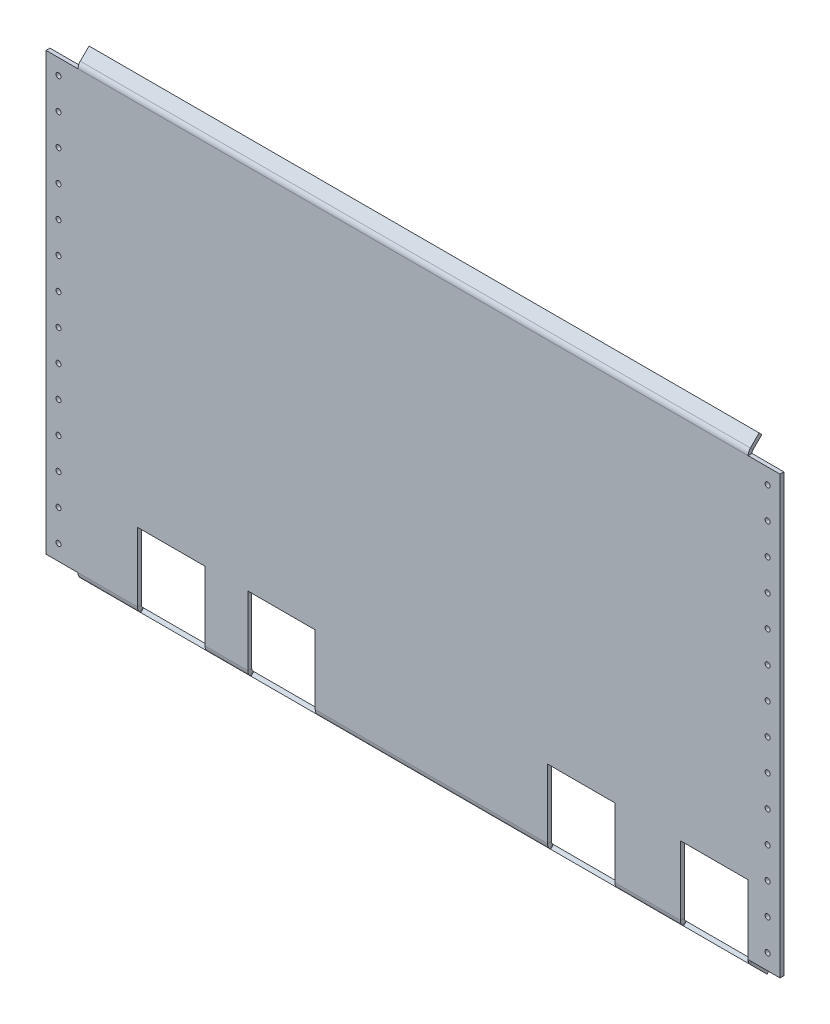
from build123d import *

# Parameters (mm, degrees)
SKETCH1_W                = 598.17
SKETCH1_H                = 355.6
BOSS_EXTRUDE1_DEPTH      = 3.175
EDGE_FLANGE1_DEPTH       = 546.1
EDGE_FLANGE2_DEPTH       = 546.1
SKETCH13_R               = 2.0701
CUT_EXTRUDE1_DEPTH       = 474.928155862
LPATTERN1_COUNT          = 14
LPATTERN1_PITCH          = 25.4
MIRROR1_COPY_1_SKETCH_R  = 2.0701
MIRROR1_COPY_1_DEPTH     = 474.928155862
MIRROR1_COPY_2_SKETCH_R  = 2.0701
MIRROR1_COPY_2_DEPTH     = 474.928155862
MIRROR1_COPY_3_SKETCH_R  = 2.0701
MIRROR1_COPY_3_DEPTH     = 474.928155862
MIRROR1_COPY_4_SKETCH_R  = 2.0701
MIRROR1_COPY_4_DEPTH     = 474.928155862
MIRROR1_COPY_5_SKETCH_R  = 2.0701
MIRROR1_COPY_5_DEPTH     = 474.928155862
MIRROR1_COPY_6_SKETCH_R  = 2.0701
MIRROR1_COPY_6_DEPTH     = 474.928155862
MIRROR1_COPY_7_SKETCH_R  = 2.0701
MIRROR1_COPY_7_DEPTH     = 474.928155862
MIRROR1_COPY_8_SKETCH_R  = 2.0701
MIRROR1_COPY_8_DEPTH     = 474.928155862
MIRROR1_COPY_9_SKETCH_R  = 2.0701
MIRROR1_COPY_9_DEPTH     = 474.928155862
MIRROR1_COPY_10_SKETCH_R = 2.0701
MIRROR1_COPY_10_DEPTH    = 474.928155862
MIRROR1_COPY_11_SKETCH_R = 2.0701
MIRROR1_COPY_11_DEPTH    = 474.928155862
MIRROR1_COPY_12_SKETCH_R = 2.0701
MIRROR1_COPY_12_DEPTH    = 474.928155862
MIRROR1_COPY_13_SKETCH_R = 2.0701
MIRROR1_COPY_13_DEPTH    = 474.928155862
CUT_EXTRUDE2_START       = -224.492278251
CUT_EXTRUDE2_DEPTH       = 54.911587961
CUT_EXTRUDE2_START_2     = -134.630234215
CUT_EXTRUDE2_2_DEPTH     = 54.911587961
CUT_EXTRUDE2_START_3     = 109.584512833
CUT_EXTRUDE2_3_DEPTH     = 54.911587961
CUT_EXTRUDE2_START_4     = 217.879930564
CUT_EXTRUDE2_4_DEPTH     = 54.911587961


# Read off the part's stored shape, not the designer's step: Cut-Extrude2
# Sheet-metal steps are written as plain solids
with BuildPart() as part:
    # Sketch1 → Boss-Extrude1 (new body)
    with BuildSketch(Plane.XY.offset(370.818659046)):
        with Locations((0, 177.8)):
            Rectangle(SKETCH1_W, SKETCH1_H)
    extrude(amount=BOSS_EXTRUDE1_DEPTH)

    # Edge-Flange1 section (across the edge) → Edge-Flange1 (add)
    with BuildSketch(Plane(origin=(273.05, -1.315128061, 370.818659046), x_dir=(0, 0.7071067811865438, -0.7071067811865512), z_dir=(-1, 0, 0))):
        with BuildLine():
            Line((-3.175, 1.315128061), (-3.175, 20.509847662))
            Line((-3.175, 20.509847662), (0, 20.509847662))
            Line((0, 20.509847662), (0, 1.315128061))
            ThreePointArc((0, 1.315128061), (0.241682484, 0.100108163), (0.92993597, -0.92993597))
            Line((0.92993597, -0.92993597), (-1.315128061, -3.175))
            ThreePointArc((-1.315128061, -3.175), (-2.691635031, -1.114911735), (-3.175, 1.315128061))
        make_face()
    extrude(amount=EDGE_FLANGE1_DEPTH)

    # Edge-Flange2 section (across the edge) → Edge-Flange2 (add)
    with BuildSketch(Plane(origin=(-273.05, 356.915128061, 370.818659046), x_dir=(0, -0.7071067811865438, -0.7071067811865512), z_dir=(1, 0, 0))):
        with BuildLine():
            Line((-3.175, 1.315128061), (-3.175, 11.384871939))
            Line((-3.175, 11.384871939), (0, 11.384871939))
            Line((0, 11.384871939), (0, 1.315128061))
            ThreePointArc((0, 1.315128061), (0.241682484, 0.100108163), (0.92993597, -0.92993597))
            Line((0.92993597, -0.92993597), (-1.315128061, -3.175))
            ThreePointArc((-1.315128061, -3.175), (-2.691635031, -1.114911735), (-3.175, 1.315128061))
        make_face()
    extrude(amount=EDGE_FLANGE2_DEPTH)

    # Sketch13 → Cut-Extrude1 (cut, symmetric)
    with BuildSketch(Plane.XY.offset(373.993659046)):
        with Locations(Location((-288.925, 342.9, 0), (0, 0, 180))):
            Circle(SKETCH13_R)
    cut_extrude1 = extrude(amount=CUT_EXTRUDE1_DEPTH, both=True, mode=Mode.SUBTRACT)

    # LPattern1: Cut-Extrude1 ×14
    with Locations(*[(0, -i * LPATTERN1_PITCH, 0) for i in range(1, LPATTERN1_COUNT)]):
        add(cut_extrude1, mode=Mode.SUBTRACT)

    # Mirror1: Cut-Extrude1 across plane
    add(cut_extrude1.mirror(Plane.ZY), mode=Mode.SUBTRACT)

    # Mirror1 copy 1 sketch → Mirror1 copy 1 (cut, symmetric)
    with BuildSketch(Plane(origin=(0, -25.4, 373.993659046), x_dir=(-1, 0, 0), z_dir=(0, 0, 1))):
        with Locations((-288.925, -342.9)):
            Circle(MIRROR1_COPY_1_SKETCH_R)
    extrude(amount=MIRROR1_COPY_1_DEPTH, both=True, mode=Mode.SUBTRACT)

    # Mirror1 copy 2 sketch → Mirror1 copy 2 (cut, symmetric)
    with BuildSketch(Plane(origin=(0, -50.8, 373.993659046), x_dir=(-1, 0, 0), z_dir=(0, 0, 1))):
        with Locations((-288.925, -342.9)):
            Circle(MIRROR1_COPY_2_SKETCH_R)
    extrude(amount=MIRROR1_COPY_2_DEPTH, both=True, mode=Mode.SUBTRACT)

    # Mirror1 copy 3 sketch → Mirror1 copy 3 (cut, symmetric)
    with BuildSketch(Plane(origin=(0, -76.2, 373.993659046), x_dir=(-1, 0, 0), z_dir=(0, 0, 1))):
        with Locations((-288.925, -342.9)):
            Circle(MIRROR1_COPY_3_SKETCH_R)
    extrude(amount=MIRROR1_COPY_3_DEPTH, both=True, mode=Mode.SUBTRACT)

    # Mirror1 copy 4 sketch → Mirror1 copy 4 (cut, symmetric)
    with BuildSketch(Plane(origin=(0, -101.6, 373.993659046), x_dir=(-1, 0, 0), z_dir=(0, 0, 1))):
        with Locations((-288.925, -342.9)):
            Circle(MIRROR1_COPY_4_SKETCH_R)
    extrude(amount=MIRROR1_COPY_4_DEPTH, both=True, mode=Mode.SUBTRACT)

    # Mirror1 copy 5 sketch → Mirror1 copy 5 (cut, symmetric)
    with BuildSketch(Plane(origin=(0, -127, 373.993659046), x_dir=(-1, 0, 0), z_dir=(0, 0, 1))):
        with Locations((-288.925, -342.9)):
            Circle(MIRROR1_COPY_5_SKETCH_R)
    extrude(amount=MIRROR1_COPY_5_DEPTH, both=True, mode=Mode.SUBTRACT)

    # Mirror1 copy 6 sketch → Mirror1 copy 6 (cut, symmetric)
    with BuildSketch(Plane(origin=(0, -152.4, 373.993659046), x_dir=(-1, 0, 0), z_dir=(0, 0, 1))):
        with Locations((-288.925, -342.9)):
            Circle(MIRROR1_COPY_6_SKETCH_R)
    extrude(amount=MIRROR1_COPY_6_DEPTH, both=True, mode=Mode.SUBTRACT)

    # Mirror1 copy 7 sketch → Mirror1 copy 7 (cut, symmetric)
    with BuildSketch(Plane(origin=(0, -177.8, 373.993659046), x_dir=(-1, 0, 0), z_dir=(0, 0, 1))):
        with Locations((-288.925, -342.9)):
            Circle(MIRROR1_COPY_7_SKETCH_R)
    extrude(amount=MIRROR1_COPY_7_DEPTH, both=True, mode=Mode.SUBTRACT)

    # Mirror1 copy 8 sketch → Mirror1 copy 8 (cut, symmetric)
    with BuildSketch(Plane(origin=(0, -203.2, 373.993659046), x_dir=(-1, 0, 0), z_dir=(0, 0, 1))):
        with Locations((-288.925, -342.9)):
            Circle(MIRROR1_COPY_8_SKETCH_R)
    extrude(amount=MIRROR1_COPY_8_DEPTH, both=True, mode=Mode.SUBTRACT)

    # Mirror1 copy 9 sketch → Mirror1 copy 9 (cut, symmetric)
    with BuildSketch(Plane(origin=(0, -228.6, 373.993659046), x_dir=(-1, 0, 0), z_dir=(0, 0, 1))):
        with Locations((-288.925, -342.9)):
            Circle(MIRROR1_COPY_9_SKETCH_R)
    extrude(amount=MIRROR1_COPY_9_DEPTH, both=True, mode=Mode.SUBTRACT)

    # Mirror1 copy 10 sketch → Mirror1 copy 10 (cut, symmetric)
    with BuildSketch(Plane(origin=(0, -254, 373.993659046), x_dir=(-1, 0, 0), z_dir=(0, 0, 1))):
        with Locations((-288.925, -342.9)):
            Circle(MIRROR1_COPY_10_SKETCH_R)
    extrude(amount=MIRROR1_COPY_10_DEPTH, both=True, mode=Mode.SUBTRACT)

    # Mirror1 copy 11 sketch → Mirror1 copy 11 (cut, symmetric)
    with BuildSketch(Plane(origin=(0, -279.4, 373.993659046), x_dir=(-1, 0, 0), z_dir=(0, 0, 1))):
        with Locations((-288.925, -342.9)):
            Circle(MIRROR1_COPY_11_SKETCH_R)
    extrude(amount=MIRROR1_COPY_11_DEPTH, both=True, mode=Mode.SUBTRACT)

    # Mirror1 copy 12 sketch → Mirror1 copy 12 (cut, symmetric)
    with BuildSketch(Plane(origin=(0, -304.8, 373.993659046), x_dir=(-1, 0, 0), z_dir=(0, 0, 1))):
        with Locations((-288.925, -342.9)):
            Circle(MIRROR1_COPY_12_SKETCH_R)
    extrude(amount=MIRROR1_COPY_12_DEPTH, both=True, mode=Mode.SUBTRACT)

    # Mirror1 copy 13 sketch → Mirror1 copy 13 (cut, symmetric)
    with BuildSketch(Plane(origin=(0, -330.2, 373.993659046), x_dir=(-1, 0, 0), z_dir=(0, 0, 1))):
        with Locations((-288.925, -342.9)):
            Circle(MIRROR1_COPY_13_SKETCH_R)
    extrude(amount=MIRROR1_COPY_13_DEPTH, both=True, mode=Mode.SUBTRACT)

    # Cut-Extrude2 outline → Cut-Extrude2 (cut)
    with BuildSketch(Plane.YZ.offset(CUT_EXTRUDE2_START)):
        with BuildLine():
            Line((-4.490128061, 372.133787106), (-5.170256121, 371.453659046))
            Line((-5.170256121, 371.453659046), (-2.925192091, 369.208595015))
            Line((-2.925192091, 369.208595015), (-2.24506403, 369.888723076))
            ThreePointArc((-2.24506403, 369.888723076), (-1.215019898, 370.576976561), (0, 370.818659046))
            Line((0, 370.818659046), (56.283587678, 370.818659046))
            Line((56.283587678, 370.818659046), (56.283587678, 373.993659046))
            Line((56.283587678, 373.993659046), (0, 373.993659046))
            ThreePointArc((0, 373.993659046), (-2.430039796, 373.510294077), (-4.490128061, 372.133787106))
        make_face()
    extrude(amount=CUT_EXTRUDE2_DEPTH, mode=Mode.SUBTRACT)

    # Cut-Extrude2 2 outline → Cut-Extrude2 2 (cut)
    with BuildSketch(Plane.YZ.offset(CUT_EXTRUDE2_START_2)):
        with BuildLine():
            Line((-4.490128061, 372.133787106), (-5.170256121, 371.453659046))
            Line((-5.170256121, 371.453659046), (-2.925192091, 369.208595015))
            Line((-2.925192091, 369.208595015), (-2.24506403, 369.888723076))
            ThreePointArc((-2.24506403, 369.888723076), (-1.215019898, 370.576976561), (0, 370.818659046))
            Line((0, 370.818659046), (56.283587678, 370.818659046))
            Line((56.283587678, 370.818659046), (56.283587678, 373.993659046))
            Line((56.283587678, 373.993659046), (0, 373.993659046))
            ThreePointArc((0, 373.993659046), (-2.430039796, 373.510294077), (-4.490128061, 372.133787106))
        make_face()
    extrude(amount=CUT_EXTRUDE2_2_DEPTH, mode=Mode.SUBTRACT)

    # Cut-Extrude2 3 outline → Cut-Extrude2 3 (cut)
    with BuildSketch(Plane.YZ.offset(CUT_EXTRUDE2_START_3)):
        with BuildLine():
            Line((-4.490128061, 372.133787106), (-5.170256121, 371.453659046))
            Line((-5.170256121, 371.453659046), (-2.925192091, 369.208595015))
            Line((-2.925192091, 369.208595015), (-2.24506403, 369.888723076))
            ThreePointArc((-2.24506403, 369.888723076), (-1.215019898, 370.576976561), (0, 370.818659046))
            Line((0, 370.818659046), (56.283587678, 370.818659046))
            Line((56.283587678, 370.818659046), (56.283587678, 373.993659046))
            Line((56.283587678, 373.993659046), (0, 373.993659046))
            ThreePointArc((0, 373.993659046), (-2.430039796, 373.510294077), (-4.490128061, 372.133787106))
        make_face()
    extrude(amount=CUT_EXTRUDE2_3_DEPTH, mode=Mode.SUBTRACT)

    # Cut-Extrude2 4 outline → Cut-Extrude2 4 (cut)
    with BuildSketch(Plane.YZ.offset(CUT_EXTRUDE2_START_4)):
        with BuildLine():
            Line((-4.490128061, 372.133787106), (-5.170256121, 371.453659046))
            Line((-5.170256121, 371.453659046), (-2.925192091, 369.208595015))
            Line((-2.925192091, 369.208595015), (-2.24506403, 369.888723076))
            ThreePointArc((-2.24506403, 369.888723076), (-1.215019898, 370.576976561), (0, 370.818659046))
            Line((0, 370.818659046), (56.283587678, 370.818659046))
            Line((56.283587678, 370.818659046), (56.283587678, 373.993659046))
            Line((56.283587678, 373.993659046), (0, 373.993659046))
            ThreePointArc((0, 373.993659046), (-2.430039796, 373.510294077), (-4.490128061, 372.133787106))
        make_face()
    extrude(amount=CUT_EXTRUDE2_4_DEPTH, mode=Mode.SUBTRACT)


solid = part.part
